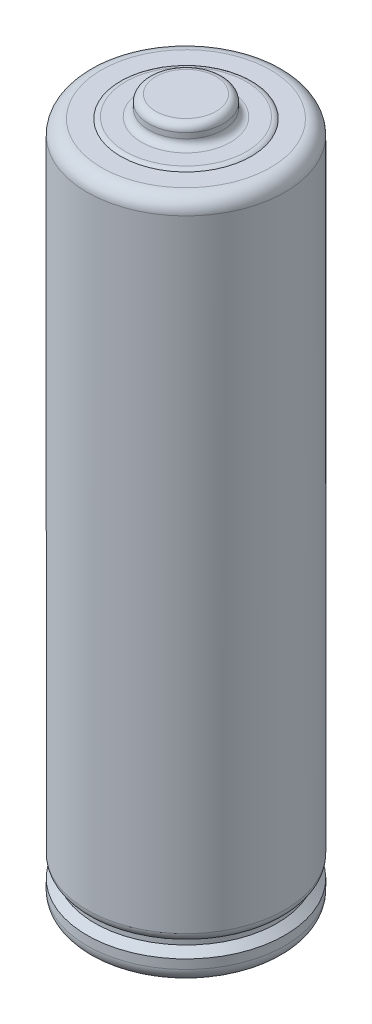
from build123d import *

# Parameters (mm, degrees)
SKETCH1_R           = 7.0231
BOSS_EXTRUDE1_DEPTH = 48.387
FILLET1_R           = 1.016
SKETCH3_R           = 4.6355
BOSS_EXTRUDE2_DEPTH = 0.127
FILLET2_R           = 0.508
SKETCH4_R           = 2.64795
BOSS_EXTRUDE3_DEPTH = 1.397
FILLET3_R           = 0.508
SKETCH6_R           = 5.3213
SKETCH6_R_2         = 4.4831
CUT_EXTRUDE1_DEPTH  = 1.397
FILLET4_R           = 0.508
FILLET5_R           = 0.508
FILLET6_R           = 1.016
SKETCH7_W           = 9.793083482
SKETCH7_H           = 0.508
CUT_EXTRUDE2_DEPTH  = 0.381


with BuildPart() as part:
    # Sketch1 → Boss-Extrude1 (new body)
    with BuildSketch(Plane(origin=(0, 0, 0), x_dir=(1, 0, 0), z_dir=(0, 1, 0))):
        with Locations(Location((0, 0, 0), (0, 0, 270))):
            Circle(SKETCH1_R)
    extrude(amount=BOSS_EXTRUDE1_DEPTH)

    # Fillet1
    fillet1_edges = [part.edges().sort_by_distance(p)[0] for p in [
        (0, 0, -7.0231),
        (0, 48.387, -7.0231),
    ]]
    fillet(fillet1_edges, radius=FILLET1_R)

    # Sketch3 → Boss-Extrude2 (add)
    with BuildSketch(Plane(origin=(0, 48.387, 0), x_dir=(1, 0, 0), z_dir=(0, 1, 0))):
        with Locations(Location((0, 0, 0), (0, 0, 270))):
            Circle(SKETCH3_R)
    extrude(amount=BOSS_EXTRUDE2_DEPTH)

    # Fillet2
    # the kernel refuses this fillet: 0.508 mm, written as the material it takes off along each edge
    with BuildSketch(Plane(origin=(0, 48.514, 0), x_dir=(0, 0, 1), z_dir=(-1, 0, 0))) as fillet2_piece_1:
        with BuildLine():
            CenterArc((4.299489583, -0.508), FILLET2_R, 48.590377891, 41.409622109)
            Line((4.299489583, 0), (4.299489583, 0.01016))
            Line((4.299489583, 0.01016), (4.6355, 0.01016))
            Line((4.6355, 0.01016), (4.64566, 0))
            ThreePointArc((4.64566, 0), (4.64566, -0.0635), (4.642220208, -0.11938))
            Line((4.642220208, -0.11938), (4.6355, -0.127))
        make_face()
    revolve(axis=Axis((0, 48.514, 0), (0, 1, 0)), mode=Mode.SUBTRACT)

    # Sketch4 → Boss-Extrude3 (add)
    with BuildSketch(Plane(origin=(0, 48.514, 0), x_dir=(1, 0, 0), z_dir=(0, 1, 0))):
        with Locations(Location((0, 0, 0), (0, 0, 270))):
            Circle(SKETCH4_R)
    extrude(amount=BOSS_EXTRUDE3_DEPTH)

    # Fillet3
    fillet3_edges = [part.edges().sort_by_distance(p)[0] for p in [
        (0, 48.514, -2.64795),
        (0, 49.911, -2.64795),
    ]]
    fillet(fillet3_edges, radius=FILLET3_R)

    # Sketch5 → Cut-Revolve2 (revolve, cut)
    with BuildSketch(Plane(origin=(0, 0, 0), x_dir=(0, 0, -1), z_dir=(1, 0, 0))):
        with BuildLine():
            ThreePointArc((7.0231, 3.219930603), (6.861397944, 2.794628212), (6.483420554, 2.541324497))
            Line((6.483420554, 2.541324497), (6.483420554, 2.138172653))
            Line((6.483420554, 2.138172653), (7.0231, 1.6637))
            Line((7.0231, 1.6637), (7.0231, 3.219930603))
        make_face()
    revolve(axis=Axis((0, 0, 0), (0, 1, 0)), mode=Mode.SUBTRACT)

    # Sketch6 → Cut-Extrude1 (cut)
    with BuildSketch(Plane.XZ):
        with Locations(Location((0, 0, 0), (0, 0, 270))):
            Circle(SKETCH6_R)
        with Locations(Location((0, 0, 0), (0, 0, 270))):
            Circle(SKETCH6_R_2, mode=Mode.SUBTRACT)
    extrude(amount=-CUT_EXTRUDE1_DEPTH, mode=Mode.SUBTRACT)

    # Fillet4
    fillet4_edges = [part.edges().sort_by_distance(p)[0] for p in [
        (0, 0, 5.3213),
    ]]
    fillet(fillet4_edges, radius=FILLET4_R)

    # Fillet5
    fillet5_edges = [part.edges().sort_by_distance(p)[0] for p in [
        (0, 1.397, 4.4831),
    ]]
    fillet(fillet5_edges, radius=FILLET5_R)

    # Fillet6
    fillet6_edges = [part.edges().sort_by_distance(p)[0] for p in [
        (0, 0, 4.4831),
    ]]
    fillet(fillet6_edges, radius=FILLET6_R)

    # Sketch7 → Cut-Extrude2 (cut, symmetric)
    with BuildSketch(Plane(origin=(0, 0, 0), x_dir=(0, 0, -1), z_dir=(1, 0, 0))):
        with Locations((-0.088254773, 0.762)):
            Rectangle(SKETCH7_W, SKETCH7_H)
    extrude(amount=CUT_EXTRUDE2_DEPTH, both=True, mode=Mode.SUBTRACT)


solid = part.part
